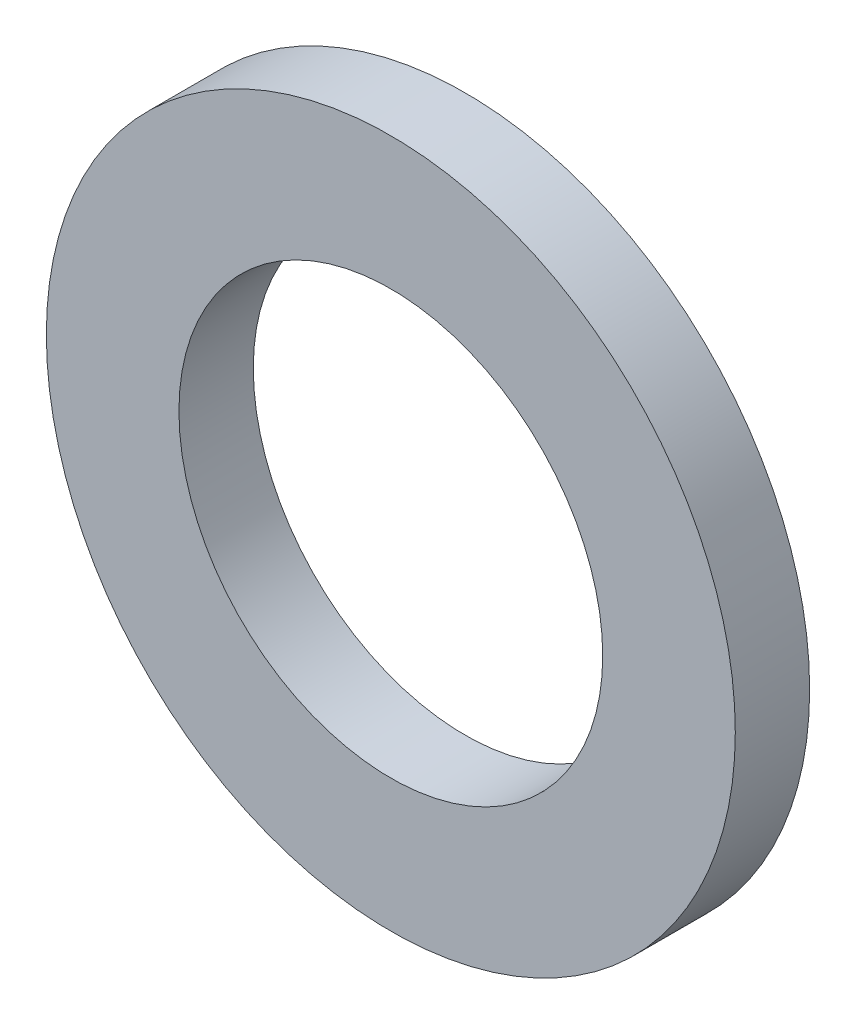
from build123d import *

# Parameters (mm, degrees)
SKETCH1_W = 3
SKETCH1_H = 5.35


with BuildPart() as part:
    # Sketch1 → Revolve1 (revolve)
    with BuildSketch(Plane(origin=(0, 0, 0), x_dir=(0, 0, -1), z_dir=(1, 0, 0))):
        with Locations((0, 11.225)):
            Rectangle(SKETCH1_W, SKETCH1_H)
    revolve(axis=Axis((0, 0, 0), (0, 0, -1)))


solid = part.part
